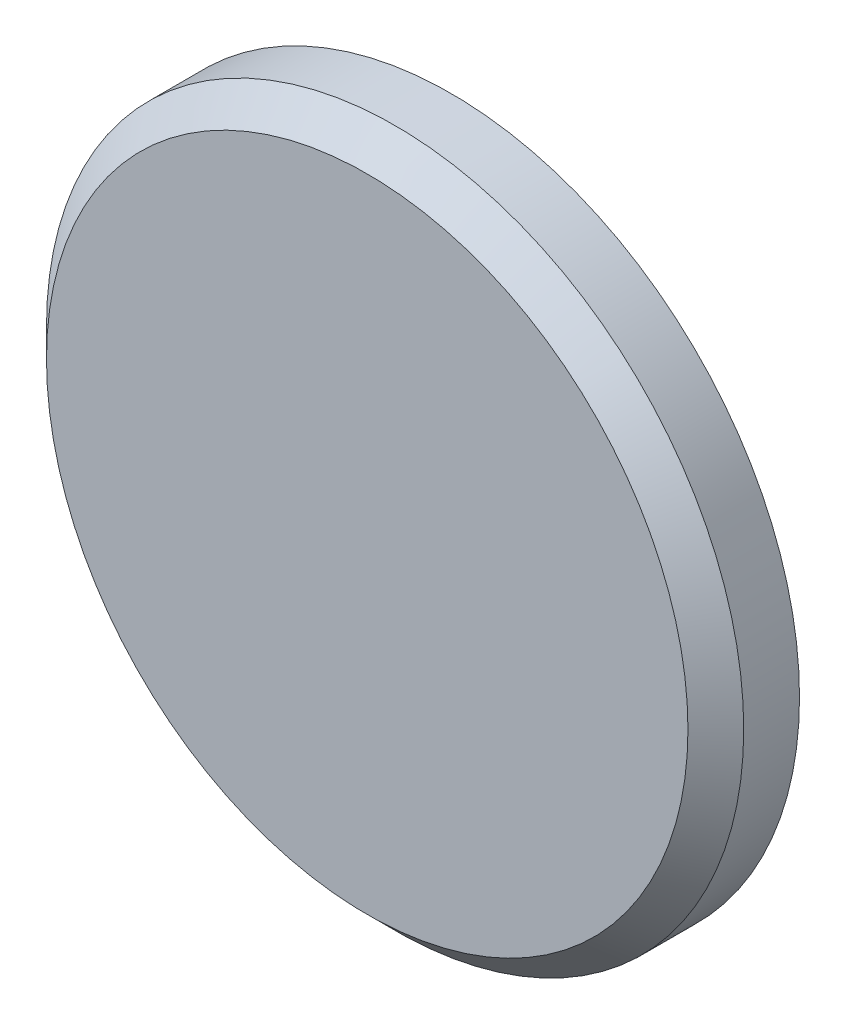
from build123d import *

# Parameters (mm, degrees)
SKETCH1_R         = 12.5
CORPO_DEPTH       = 3
CHANFRO_1X45_SIZE = 1


with BuildPart() as part:
    # Sketch1 → Corpo (new body)
    with BuildSketch(Plane.XY):
        Circle(SKETCH1_R)
    extrude(amount=-CORPO_DEPTH)

    # Chanfro 1x45°
    chanfro_1x45_edges = [part.edges().sort_by_distance(p)[0] for p in [
        (-12.5, 0, 0),
    ]]
    chamfer(chanfro_1x45_edges, length=CHANFRO_1X45_SIZE)


solid = part.part
